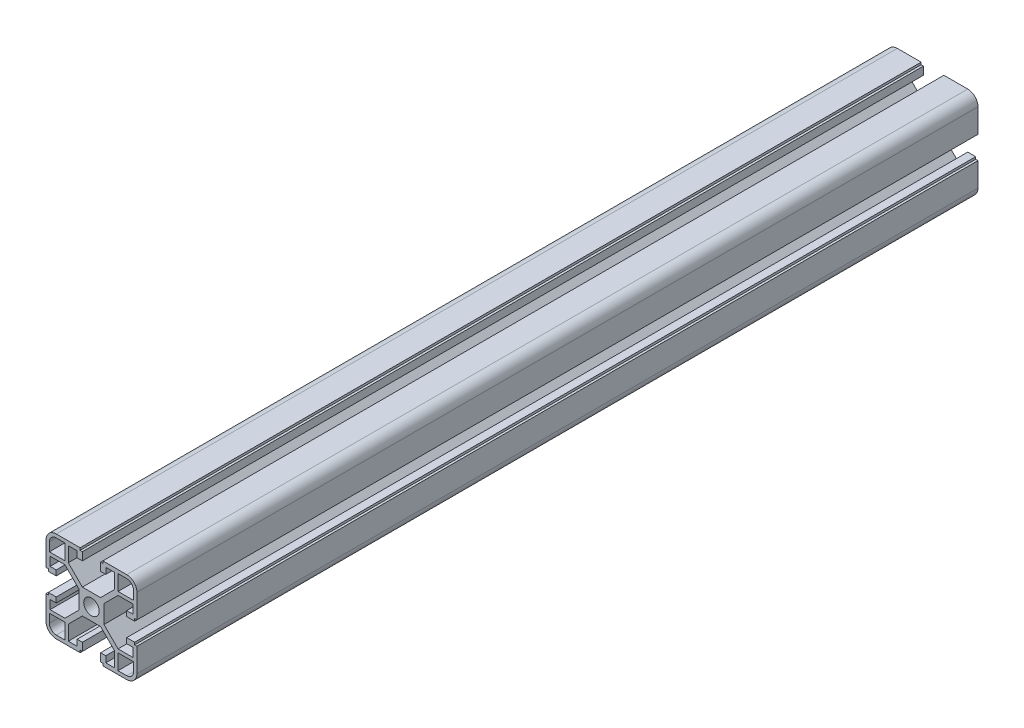
from build123d import *
from build123d.topology import SkipClean

# Parameters (mm, degrees)
BOSS_EXTRUDE1_DEPTH  = 370
MIRROR3_COPY_1_DEPTH = 370
MIRROR3_COPY_2_DEPTH = 370


with BuildPart() as part:
    # Sketch1 → Boss-Extrude1 (new body)
    with BuildSketch(Plane.XY):
        with BuildLine():
            Line((3.4, 0), (5.5, 0))
            Line((5.5, 0), (5.5, 4))
            Line((5.5, 4), (11.69, 10.19))
            Line((11.69, 10.19), (18.2, 10.19))
            Line((18.2, 10.19), (18.2, 6.3))
            Line((18.2, 6.3), (15.5, 6.3))
            Line((15.5, 6.3), (15.5, 4))
            Line((15.5, 4), (19, 4))
            Line((19, 4), (19, 5))
            Line((19, 5), (20, 5))
            Line((20, 5), (20, 15.5))
            ThreePointArc((20, 15.5), (18.681980515, 18.681980515), (15.5, 20))
            Line((15.5, 20), (5, 20))
            Line((5, 20), (5, 19))
            Line((5, 19), (4, 19))
            Line((4, 19), (4, 15.5))
            Line((4, 15.5), (6.3, 15.5))
            Line((6.3, 15.5), (6.3, 18.2))
            Line((6.3, 18.2), (10.19, 18.2))
            Line((10.19, 18.2), (10.19, 11.69))
            Line((10.19, 11.69), (4, 5.5))
            Line((4, 5.5), (0, 5.5))
            Line((0, 5.5), (0, 3.4))
            ThreePointArc((0, 3.4), (2.404163056, 2.404163056), (3.4, 0))
        make_face()
        with BuildLine():
            Line((18.5, 11.69), (18.5, 15.5))
            ThreePointArc((18.5, 15.5), (17.621320344, 17.621320344), (15.5, 18.5))
            Line((15.5, 18.5), (11.69, 18.5))
            Line((11.69, 18.5), (11.69, 11.69))
            Line((11.69, 11.69), (18.5, 11.69))
        make_face(mode=Mode.SUBTRACT)
    boss_extrude1 = extrude(amount=BOSS_EXTRUDE1_DEPTH)

    # Mirror1: Boss-Extrude1 across plane
    add(boss_extrude1.mirror(Plane.ZX))

    # Mirror2: Boss-Extrude1 across plane
    add(boss_extrude1.mirror(Plane(origin=(0, 0, 0), x_dir=(0, 0, 1), z_dir=(1, 0, 0))))

    # Mirror3 copy 1 sketch → Mirror3 copy 1 (add)
    with BuildSketch(Plane(origin=(0, 0, 0), x_dir=(-1, 0, 0), z_dir=(0, 0, 1))):
        with BuildLine():
            Line((3.4, 0), (5.5, 0))
            Line((5.5, 0), (5.5, 4))
            Line((5.5, 4), (11.69, 10.19))
            Line((11.69, 10.19), (18.2, 10.19))
            Line((18.2, 10.19), (18.2, 6.3))
            Line((18.2, 6.3), (15.5, 6.3))
            Line((15.5, 6.3), (15.5, 4))
            Line((15.5, 4), (19, 4))
            Line((19, 4), (19, 5))
            Line((19, 5), (20, 5))
            Line((20, 5), (20, 15.5))
            ThreePointArc((20, 15.5), (18.681980515, 18.681980515), (15.5, 20))
            Line((15.5, 20), (5, 20))
            Line((5, 20), (5, 19))
            Line((5, 19), (4, 19))
            Line((4, 19), (4, 15.5))
            Line((4, 15.5), (6.3, 15.5))
            Line((6.3, 15.5), (6.3, 18.2))
            Line((6.3, 18.2), (10.19, 18.2))
            Line((10.19, 18.2), (10.19, 11.69))
            Line((10.19, 11.69), (4, 5.5))
            Line((4, 5.5), (0, 5.5))
            Line((0, 5.5), (0, 3.4))
            ThreePointArc((0, 3.4), (2.404163056, 2.404163056), (3.4, 0))
        make_face()
        with BuildLine():
            Line((18.5, 11.69), (18.5, 15.5))
            ThreePointArc((18.5, 15.5), (17.621320344, 17.621320344), (15.5, 18.5))
            Line((15.5, 18.5), (11.69, 18.5))
            Line((11.69, 18.5), (11.69, 11.69))
            Line((11.69, 11.69), (18.5, 11.69))
        make_face(mode=Mode.SUBTRACT)
    extrude(amount=MIRROR3_COPY_1_DEPTH)

    # Mirror3 copy 2 sketch → Mirror3 copy 2 (add)
    with SkipClean():  # the faces are left unmerged after this step: merging them gives an invalid solid
        with BuildSketch(Plane.XY):
            with BuildLine():
                Line((3.4, 0), (5.5, 0))
                Line((5.5, 0), (5.5, -4))
                Line((5.5, -4), (11.69, -10.19))
                Line((11.69, -10.19), (18.2, -10.19))
                Line((18.2, -10.19), (18.2, -6.3))
                Line((18.2, -6.3), (15.5, -6.3))
                Line((15.5, -6.3), (15.5, -4))
                Line((15.5, -4), (19, -4))
                Line((19, -4), (19, -5))
                Line((19, -5), (20, -5))
                Line((20, -5), (20, -15.5))
                ThreePointArc((20, -15.5), (18.681980515, -18.681980515), (15.5, -20))
                Line((15.5, -20), (5, -20))
                Line((5, -20), (5, -19))
                Line((5, -19), (4, -19))
                Line((4, -19), (4, -15.5))
                Line((4, -15.5), (6.3, -15.5))
                Line((6.3, -15.5), (6.3, -18.2))
                Line((6.3, -18.2), (10.19, -18.2))
                Line((10.19, -18.2), (10.19, -11.69))
                Line((10.19, -11.69), (4, -5.5))
                Line((4, -5.5), (0, -5.5))
                Line((0, -5.5), (0, -3.4))
                ThreePointArc((0, -3.4), (2.404163056, -2.404163056), (3.4, 0))
            make_face()
            with BuildLine():
                Line((18.5, -11.69), (18.5, -15.5))
                ThreePointArc((18.5, -15.5), (17.621320344, -17.621320344), (15.5, -18.5))
                Line((15.5, -18.5), (11.69, -18.5))
                Line((11.69, -18.5), (11.69, -11.69))
                Line((11.69, -11.69), (18.5, -11.69))
            make_face(mode=Mode.SUBTRACT)
        extrude(amount=MIRROR3_COPY_2_DEPTH)


solid = part.part
